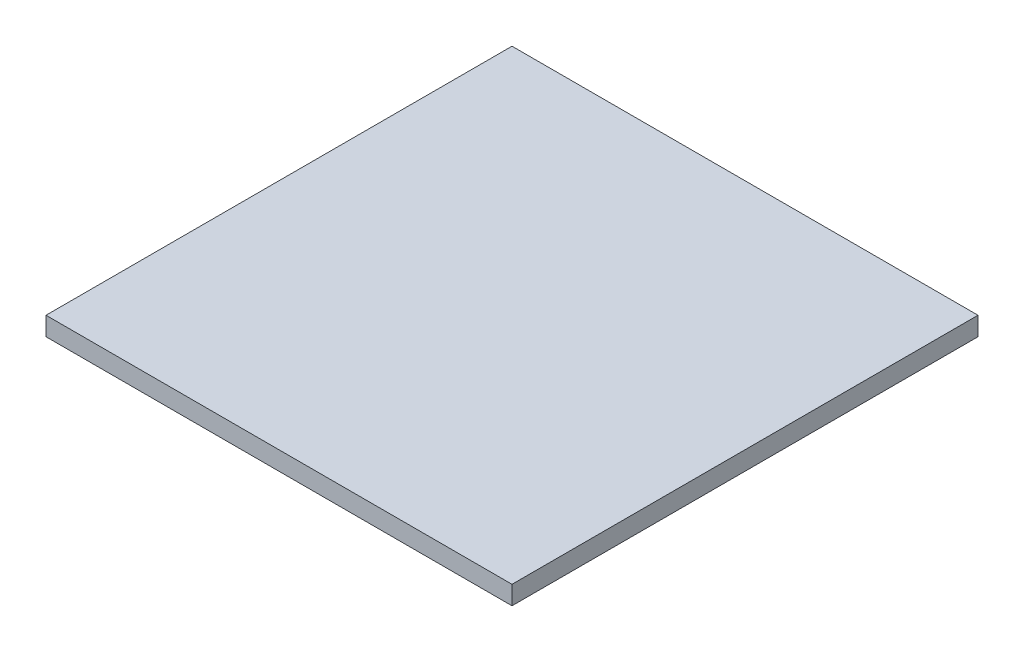
from build123d import *

# Parameters (mm, degrees)
SKETCH1_W           = 75
SKETCH1_H           = 75
BOSS_EXTRUDE1_DEPTH = 3


with BuildPart() as part:
    # Sketch1 → Boss-Extrude1 (new body)
    with BuildSketch(Plane(origin=(0, 0, 0), x_dir=(1, 0, 0), z_dir=(0, 1, 0))):
        Rectangle(SKETCH1_W, SKETCH1_H)
    extrude(amount=BOSS_EXTRUDE1_DEPTH)


solid = part.part
